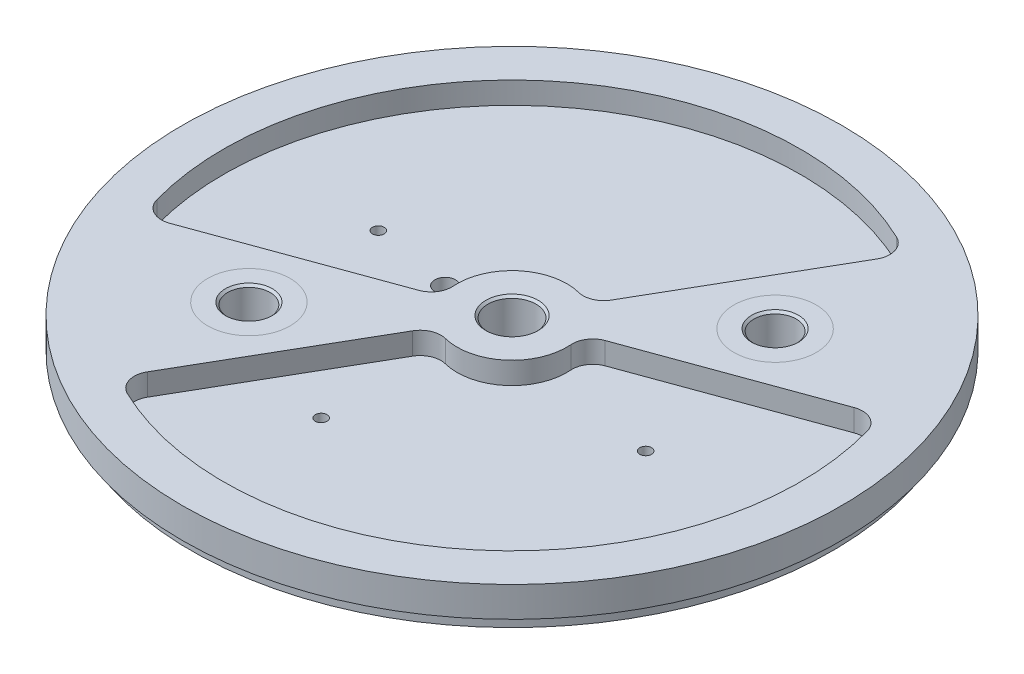
from build123d import *

# Parameters (mm, degrees)
SKETCH1_R                      = 76.2
BOSS_EXTRUDE1_DEPTH            = 10.16
TAP_DRILL_FOR_6_32_TAP1_D      = 2.7051
CIRPATTERN1_COUNT              = 4
W_0_386_DIAMETER_HOLE1_D       = 9.8044
F_3_16_0_1875_DIAMETER_HOLE1_D = 4.7625
CUT_EXTRUDE4_DEPTH             = 3.175
F_7_16_0_4375_DIAMETER_HOLE1_D = 11.1125
SKETCH15_R                     = 76.2
SKETCH15_R_2                   = 74.041
CUT_EXTRUDE5_DEPTH             = 3.175
CHAMFER2_SIZE                  = 0.508
SKETCH20_R                     = 1.35255
SKETCH20_R_2                   = 2.38125
CUT_EXTRUDE7_DEPTH             = 5.08


with BuildPart() as part:
    # Sketch1 → Boss-Extrude1 (new body)
    with BuildSketch(Plane(origin=(0, 0, 0), x_dir=(1, 0, 0), z_dir=(0, 1, 0))):
        Circle(SKETCH1_R)
    extrude(amount=BOSS_EXTRUDE1_DEPTH)

    # Tap Drill for #6-32 Tap1 (through all)
    with Locations(Plane(origin=(0, 0, 0), x_dir=(-1, 0, 0), z_dir=(0, -1, 0))):
        with Locations((37.52117539, 6.615995569)):
            tap_drill_for_6_32_tap1 = Hole(TAP_DRILL_FOR_6_32_TAP1_D / 2)

    # CirPattern1: Tap Drill for #6-32 Tap1 ×4 about axis, 1 skipped
    cirpattern1_axis = Axis((0, 0, 0), (0, 1, 0))
    add([tap_drill_for_6_32_tap1.rotate(cirpattern1_axis, i * 360 / CIRPATTERN1_COUNT) for i in range(1, CIRPATTERN1_COUNT) if i not in (3,)], mode=Mode.SUBTRACT)

    # W (0.386) Diameter Hole1 (through all)
    with Locations(Plane(origin=(0, 0, 0), x_dir=(-1, 0, 0), z_dir=(0, -1, 0))):
        with Locations((-33.077799054, 27.755568986), (33.077799054, -27.755568986)):
            Hole(W_0_386_DIAMETER_HOLE1_D / 2)

    # 3/16 (0.1875) Diameter Hole1 (through all)
    with Locations(Plane(origin=(0, 0, 0), x_dir=(-1, 0, 0), z_dir=(0, -1, 0))):
        with Locations((18.760587695, 3.307997785)):
            Hole(F_3_16_0_1875_DIAMETER_HOLE1_D / 2)

    # Sketch12 → Cut-Extrude4 (cut)
    with BuildSketch(Plane.XZ):
        with BuildLine():
            Line((19.886888313, 28.738482206), (6.498907978, 12.783308544))
            ThreePointArc((6.498907978, 12.783308544), (6.898075233, 8.220805941), (11.460577836, 8.619973196))
            Line((11.460577836, 8.619973196), (24.848558171, 24.575146858))
            ThreePointArc((24.848558171, 24.575146858), (24.449390916, 29.137649461), (19.886888313, 28.738482206))
        make_face()
    cut_extrude4 = extrude(amount=-CUT_EXTRUDE4_DEPTH, mode=Mode.SUBTRACT)

    # Mirror1: Cut-Extrude4 across plane
    add(cut_extrude4.mirror(Plane(origin=(0, 0, 0), x_dir=(-0.7660444431189792, 0, 0.6427876096865378), z_dir=(0.6427876096865379, 0, 0.7660444431189792))), mode=Mode.SUBTRACT)

    # 7/16 (0.4375) Diameter Hole1 (through all)
    with Locations(Plane(origin=(0, 0, 0), x_dir=(-1, 0, 0), z_dir=(0, -1, 0))):
        with Locations((0, 0)):
            Hole(F_7_16_0_4375_DIAMETER_HOLE1_D / 2)

    # Sketch15 → Cut-Extrude5 (cut)
    with BuildSketch(Plane.XZ):
        Circle(SKETCH15_R)
        Circle(SKETCH15_R_2, mode=Mode.SUBTRACT)
    extrude(amount=-CUT_EXTRUDE5_DEPTH, mode=Mode.SUBTRACT)

    # Chamfer2
    chamfer2_edges = [part.edges().sort_by_distance(p)[0] for p in [
        (-37.979999054, 0, 27.755568986),
        (28.175599054, 0, -27.755568986),
        (-37.979999054, 10.16, 27.755568986),
        (28.175599054, 10.16, -27.755568986),
        (-5.55625, 0, 0),
        (-5.55625, 10.16, 0),
    ]]
    chamfer(chamfer2_edges, length=CHAMFER2_SIZE)

    # Sketch20 → Cut-Extrude7 (cut)
    # profile 1 of 2: a face of its own
    with BuildSketch(Plane(origin=(0, 10.16, 0), x_dir=(1, 0, 0), z_dir=(0, 1, 0))):
        with BuildLine():
            Line((58.006337644, 21.112580301), (15.787325383, 5.746116518))
            ThreePointArc((15.787325383, 5.746116518), (13.41810781, 3.858627578), (12.666324636, 0.92424034))
            ThreePointArc((12.666324636, 0.92424034), (8.163402625, -9.728764443), (-3.109683289, -12.313402042))
            ThreePointArc((-3.109683289, -12.313402042), (-6.130036388, -12.544212982), (-8.400260426, -14.549677855))
            Line((-8.400260426, -14.549677855), (-30.864527746, -53.458930208))
            ThreePointArc((-30.864527746, -53.458930208), (-31.28945063, -57.248955123), (-28.797011077, -60.135578304))
            ThreePointArc((-28.797011077, -60.135578304), (42.857863777, -51.076013328), (64.222532311, 17.917085938))
            ThreePointArc((64.222532311, 17.917085938), (61.812570917, 20.872916849), (58.006337644, 21.112580301))
        make_face()
        with Locations((-6.615995569, -37.52117539)):
            Circle(SKETCH20_R, mode=Mode.SUBTRACT)
        with Locations((37.52117539, -6.615995569)):
            Circle(SKETCH20_R, mode=Mode.SUBTRACT)
    # profile 2 of 2: a face of its own
    with BuildSketch(Plane(origin=(0, 10.16, 0), x_dir=(1, 0, 0), z_dir=(0, 1, 0))):
        with BuildLine():
            ThreePointArc((-12.666324642, -0.924240256), (-8.16340261, 9.728764456), (3.109683246, 12.313402053))
            ThreePointArc((3.109683246, 12.313402053), (6.130036351, 12.544212967), (8.400260408, 14.549677823))
            Line((8.400260408, 14.549677823), (30.864527463, 53.458929718))
            ThreePointArc((30.864527463, 53.458929718), (31.289450636, 57.248955104), (28.797010604, 60.135578531))
            ThreePointArc((28.797010604, 60.135578531), (-42.857863971, 51.076013165), (-64.222532316, -17.91708592))
            ThreePointArc((-64.222532316, -17.91708592), (-61.812570882, -20.872916867), (-58.006337553, -21.112580268))
            Line((-58.006337553, -21.112580268), (-15.787325417, -5.746116531))
            ThreePointArc((-15.787325417, -5.746116531), (-13.418107797, -3.858627558), (-12.666324642, -0.924240256))
        make_face()
        with Locations((-18.760587695, 3.307997785)):
            Circle(SKETCH20_R_2, mode=Mode.SUBTRACT)
        with Locations((-37.52117539, 6.615995569)):
            Circle(SKETCH20_R, mode=Mode.SUBTRACT)
    extrude(amount=-CUT_EXTRUDE7_DEPTH, mode=Mode.SUBTRACT)


solid = part.part
